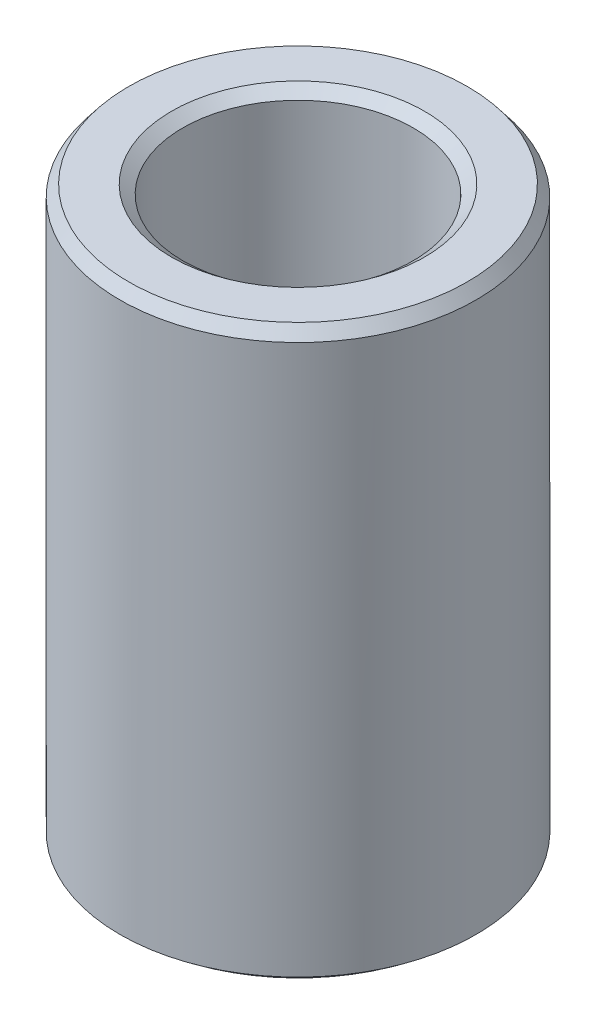
from build123d import *
from OCP.BRepFilletAPI import BRepFilletAPI_MakeChamfer

# Parameters (mm, degrees)
SKETCH1_R           = 40
BOSS_EXTRUDE1_DEPTH = 127.948244335
SKETCH2_R           = 25.875293593
CUT_EXTRUDE1_DEPTH  = 140.89550825
CHAMFER1_SIZE       = 2.534590817
CHAMFER1_SIZE2      = 1.966948095


with BuildPart() as part:
    # Sketch1 → Boss-Extrude1 (new body)
    with BuildSketch(Plane(origin=(0, 0, 0), x_dir=(1, 0, 0), z_dir=(0, 1, 0))):
        Circle(SKETCH1_R)
    extrude(amount=BOSS_EXTRUDE1_DEPTH)

    # Sketch2 → Cut-Extrude1 (cut, through all)
    with BuildSketch(Plane(origin=(0, 0, 0), x_dir=(1, 0, 0), z_dir=(0, 1, 0))):
        Circle(SKETCH2_R)
    extrude(amount=CUT_EXTRUDE1_DEPTH, mode=Mode.SUBTRACT)

    # Chamfer1: one chamfer whose edges measure the first distance from different faces: ONE call of the kernel's chamfer builder (chamfer() names one face for all edges)
    chamfer1_edges_1 = [part.edges().sort_by_distance(p)[0] for p in [
        (-25.875293593, 127.948244335, 0),
    ]]
    chamfer1_side_1 = [part.faces().sort_by_distance(p)[0] for p in [
        (-38.86862915, 127.948244335, 0),
    ]]
    chamfer1_edges_2 = [part.edges().sort_by_distance(p)[0] for p in [
        (-25.875293593, 0, 0),
    ]]
    chamfer1_side_2 = [part.faces().sort_by_distance(p)[0] for p in [
        (-25.875293593, 63.974122168, 0),
    ]]
    chamfer1_edges_3 = [part.edges().sort_by_distance(p)[0] for p in [
        (-40, 0, 0),
    ]]
    chamfer1_side_3 = [part.faces().sort_by_distance(p)[0] for p in [
        (-38.86862915, 0, 0),
    ]]
    chamfer1_edges_4 = [part.edges().sort_by_distance(p)[0] for p in [
        (-40, 127.948244335, 0),
    ]]
    chamfer1_side_4 = [part.faces().sort_by_distance(p)[0] for p in [
        (-40, 63.974122168, 0),
    ]]
    chamfer1 = BRepFilletAPI_MakeChamfer(part.part.solid().wrapped)
    for e in chamfer1_edges_1:
        chamfer1.Add(CHAMFER1_SIZE, CHAMFER1_SIZE2, e.wrapped, chamfer1_side_1[0].wrapped)  # the first distance lies on this face
    for e in chamfer1_edges_2:
        chamfer1.Add(CHAMFER1_SIZE, CHAMFER1_SIZE2, e.wrapped, chamfer1_side_2[0].wrapped)  # the first distance lies on this face
    for e in chamfer1_edges_3:
        chamfer1.Add(CHAMFER1_SIZE, CHAMFER1_SIZE2, e.wrapped, chamfer1_side_3[0].wrapped)  # the first distance lies on this face
    for e in chamfer1_edges_4:
        chamfer1.Add(CHAMFER1_SIZE, CHAMFER1_SIZE2, e.wrapped, chamfer1_side_4[0].wrapped)  # the first distance lies on this face
    add(Compound.cast(chamfer1.Shape()), mode=Mode.REPLACE)


solid = part.part
